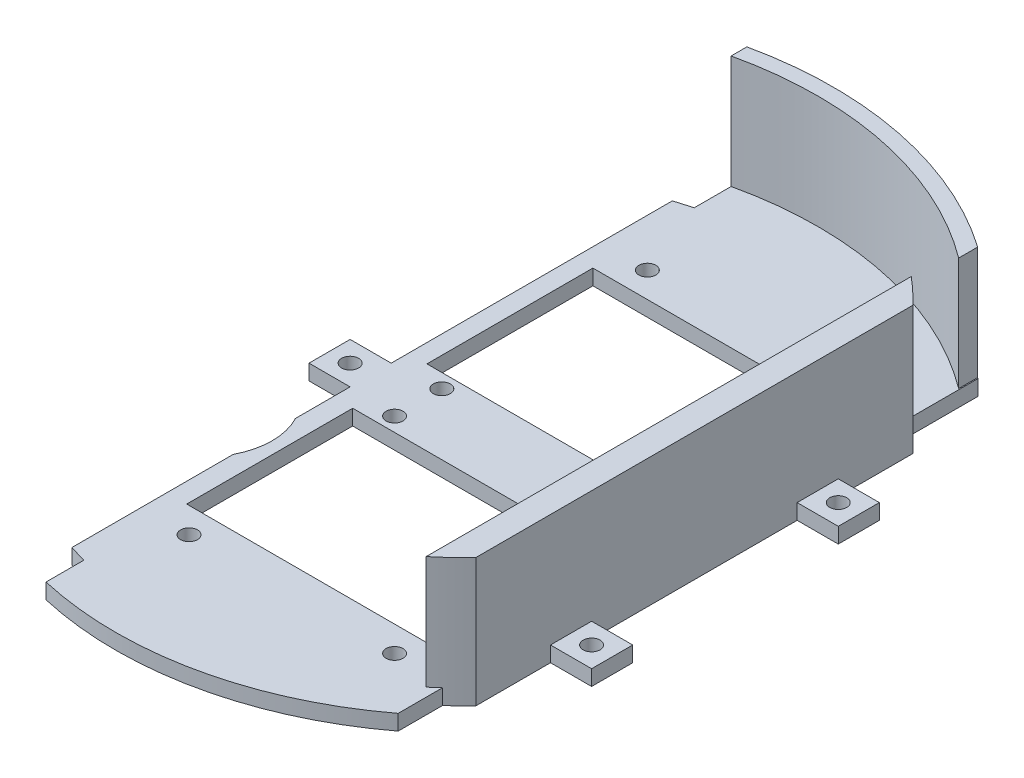
from build123d import *

# Parameters (mm, degrees)
SKETCH1_W           = 8
SKETCH1_H           = 8
SKETCH1_R           = 1.65
BOSS_EXTRUDE1_DEPTH = 3
BOSS_EXTRUDE2_DEPTH = 22
SKETCH3_R           = 13
CUT_EXTRUDE1_DEPTH  = 92.431135288
CUT_EXTRUDE3_DEPTH  = 3
SKETCH6_R           = 1.65
SKETCH6_W           = 51.3
SKETCH6_H           = 32.3
CUT_EXTRUDE4_DEPTH  = 93.198983183
BOSS_EXTRUDE4_DEPTH = 25
CUT_EXTRUDE5_DEPTH  = 93.198983183


# Read off the part's stored shape, not the designer's step: Cut-Extrude3
with BuildPart() as part:
    # Sketch1 → Boss-Extrude1 (new body)
    # profile 1 of 4: a face of its own
    with BuildSketch(Plane(origin=(0, 0, 0), x_dir=(1, 0, 0), z_dir=(0, 1, 0))):
        with BuildLine():
            Line((-18.5, 69.116947994), (-18.5, 4))
            Line((-18.5, 4), (-18.5, -4))
            Line((-18.5, -4), (-18.5, -65.642897559))
            ThreePointArc((-18.5, -65.642897559), (14.755653403, -66.584613032), (44.5, -51.681621492))
            Line((44.5, -51.681621492), (44.5, -28))
            Line((44.5, -28), (44.5, -20))
            Line((44.5, -20), (44.5, 20))
            Line((44.5, 20), (44.5, 28))
            Line((44.5, 28), (44.5, 55))
            Line((44.5, 55), (44.5, 56.028140251))
            ThreePointArc((44.5, 56.028140251), (14.554354058, 70.054073957), (-18.5, 69.116947994))
        make_face()
    # profile 2 of 4: a face of its own
    with BuildSketch(Plane(origin=(0, 0, 0), x_dir=(1, 0, 0), z_dir=(0, 1, 0))):
        with Locations((-22.5, 0)):
            Rectangle(SKETCH1_W, SKETCH1_H)
        with Locations(Location((-22.5, 0, 0), (0, 0, 270))):
            Circle(SKETCH1_R, mode=Mode.SUBTRACT)
    # profile 3 of 4: a face of its own
    with BuildSketch(Plane(origin=(0, 0, 0), x_dir=(1, 0, 0), z_dir=(0, 1, 0))):
        with Locations((48.5, -24)):
            Rectangle(SKETCH1_W, SKETCH1_H)
        with Locations(Location((48.5, -24, 0), (0, 0, 270))):
            Circle(SKETCH1_R, mode=Mode.SUBTRACT)
    # profile 4 of 4: a face of its own
    with BuildSketch(Plane(origin=(0, 0, 0), x_dir=(1, 0, 0), z_dir=(0, 1, 0))):
        with Locations((48.5, 24)):
            Rectangle(SKETCH1_W, SKETCH1_H)
        with Locations(Location((48.5, 24, 0), (0, 0, 270))):
            Circle(SKETCH1_R, mode=Mode.SUBTRACT)
    extrude(amount=BOSS_EXTRUDE1_DEPTH)

    # Sketch2 → Boss-Extrude2 (add)
    with BuildSketch(Plane(origin=(0, 3, 0), x_dir=(1, 0, 0), z_dir=(0, 1, 0))):
        with BuildLine():
            Line((44.5, -42.522376462), (44.5, 42.522376462))
            ThreePointArc((44.5, 42.522376462), (42.065161183, 44.932446124), (39.5, 47.203310265))
            Line((39.5, 47.203310265), (39.5, -47.203310265))
            ThreePointArc((39.5, -47.203310265), (42.065161183, -44.932446124), (44.5, -42.522376462))
        make_face()
    extrude(amount=BOSS_EXTRUDE2_DEPTH)

    # Sketch3 → Cut-Extrude1 (cut, through all)
    with BuildSketch(Plane(origin=(0, 3, 0), x_dir=(1, 0, 0), z_dir=(0, 1, 0))):
        with Locations((-30, -20.7)):
            Circle(SKETCH3_R)
    extrude(amount=-CUT_EXTRUDE1_DEPTH, mode=Mode.SUBTRACT)

    # Cut-Extrude3 outline → Cut-Extrude3 (cut)
    with BuildSketch(Plane(origin=(0, 0, 0), x_dir=(1, 0, 0), z_dir=(0, 1, 0))):
        with BuildLine():
            Line((44.5, -51.681621492), (44.5, -42.522376462))
            ThreePointArc((44.5, -42.522376462), (42.879948374, -44.155549226), (41.2, -45.727043421))
            Line((41.2, -45.727043421), (41.2, -54.348873033))
            ThreePointArc((41.2, -54.348873033), (42.870748276, -53.040917623), (44.5, -51.681621492))
        make_face()
        with BuildLine():
            ThreePointArc((41.2, 45.727043421), (42.879948374, 44.155549226), (44.5, 42.522376462))
            Line((44.5, 42.522376462), (44.5, 56.028140251))
            ThreePointArc((44.5, 56.028140251), (42.867784957, 57.286608495), (41.2, 58.497542683))
            Line((41.2, 58.497542683), (41.2, 45.727043421))
        make_face()
        with BuildLine():
            ThreePointArc((-18.5, -65.642897559), (-16.85525465, -66.084343007), (-15.2, -66.484584679))
            Line((-15.2, -66.484584679), (-15.2, -59.091509852))
            ThreePointArc((-15.2, -59.091509852), (-16.856674237, -58.640421812), (-18.5, -58.142897559))
            Line((-18.5, -58.142897559), (-18.5, -65.642897559))
        make_face()
    extrude(amount=CUT_EXTRUDE3_DEPTH, mode=Mode.SUBTRACT)

    # Sketch6 → Cut-Extrude4 (cut, through all)
    with BuildSketch(Plane(origin=(0, 0, 0), x_dir=(1, 0, 0), z_dir=(0, 1, 0))):
        with Locations(Location((-9.25, 44.6, 0), (0, 0, 90))):
            Circle(SKETCH6_R)
        with Locations(Location((-9.25, 4.6, 0), (0, 0, 90))):
            Circle(SKETCH6_R)
        with Locations(Location((30.75, 4.6, 0), (0, 0, 90))):
            Circle(SKETCH6_R)
        with Locations(Location((30.75, 44.6, 0), (0, 0, 90))):
            Circle(SKETCH6_R)
        with Locations(Location((-9.25, -4.6, 0), (0, 0, 90))):
            Circle(SKETCH6_R)
        with Locations(Location((30.75, -4.6, 0), (0, 0, 90))):
            Circle(SKETCH6_R)
        with Locations(Location((30.75, -44.6, 0), (0, 0, 90))):
            Circle(SKETCH6_R)
        with Locations(Location((-9.25, -44.6, 0), (0, 0, 90))):
            Circle(SKETCH6_R)
        with Locations((10.75, 23.5)):
            Rectangle(SKETCH6_W, SKETCH6_H)
        with Locations((11, -23.5)):
            Rectangle(SKETCH6_W, SKETCH6_H)
    extrude(amount=CUT_EXTRUDE4_DEPTH, mode=Mode.SUBTRACT)

    # Sketch8 → Boss-Extrude4 (add)
    with BuildSketch(Plane(origin=(0, 0, 0), x_dir=(1, 0, 0), z_dir=(0, 1, 0))):
        with BuildLine():
            Line((41, 58.637893039), (41, 54.93725967))
            ThreePointArc((41, 54.93725967), (14.207393879, 67.061557238), (-15.2, 66.843567379))
            Line((-15.2, 66.843567379), (-15.2, 69.916825586))
            ThreePointArc((-15.2, 69.916825586), (14.078834464, 70.151186164), (41, 58.637893039))
        make_face()
    extrude(amount=BOSS_EXTRUDE4_DEPTH)

    # Sketch9 → Cut-Extrude5 (cut, through all)
    with BuildSketch(Plane(origin=(0, 0, 0), x_dir=(1, 0, 0), z_dir=(0, 1, 0))):
        with BuildLine():
            Line((-18.5, 58.703939391), (-18.5, 74.933190401))
            Line((-18.5, 74.933190401), (-15.2, 74.933190401))
            Line((-15.2, 74.933190401), (-15.2, 59.643629165))
            ThreePointArc((-15.2, 59.643629165), (-16.856549297, 59.196784083), (-18.5, 58.703939391))
        make_face()
    extrude(amount=CUT_EXTRUDE5_DEPTH, mode=Mode.SUBTRACT)


solid = part.part
